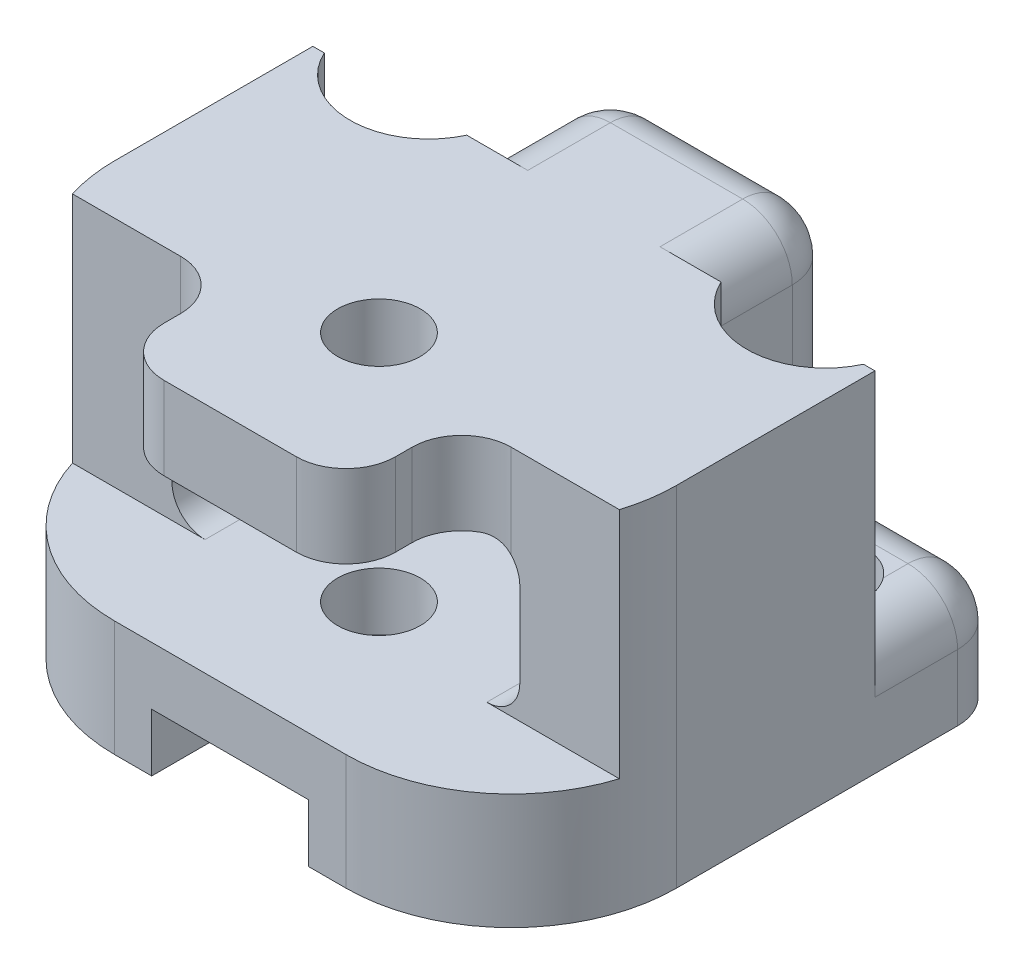
from build123d import *

# Parameters (mm, degrees)
CROQUIS1_W              = 34
CROQUIS1_H              = 30
CROQUIS1_R              = 2.5
SALIENTE_EXTRUIR1_DEPTH = 7
REDONDEO1_R             = 10
CROQUIS2_W              = 14
CROQUIS2_H              = 30
SALIENTE_EXTRUIR2_DEPTH = 14.1
CORTAR_EXTRUIR1_REACH   = 45.832
CORTAR_EXTRUIR2_REACH   = 52.012
CROQUIS4_R              = 2.5
CROQUIS5_W              = 9.5
CROQUIS5_H              = 3.5
CORTAR_EXTRUIR3_DEPTH   = 20
SALIENTE_EXTRUIR3_DEPTH = 5
SALIENTE_EXTRUIR4_DEPTH = 9.1
CORTAR_EXTRUIR4_REACH   = 52.012
CROQUIS8_R              = 4.75
REDONDEO5_R             = 2
REDONDEO6_R             = 3
REDONDEO7_R             = 3


with BuildPart() as part:
    # Croquis1 → Saliente-Extruir1 (new body)
    with BuildSketch(Plane(origin=(0, 0, 0), x_dir=(1, 0, 0), z_dir=(0, 1, 0))):
        with Locations((-17, -15)):
            Rectangle(CROQUIS1_W, CROQUIS1_H)
        with Locations(Location((-29, -6, 0), (0, 0, 90))):
            Circle(CROQUIS1_R, mode=Mode.SUBTRACT)
        with Locations(Location((-5, -6, 0), (0, 0, 90))):
            Circle(CROQUIS1_R, mode=Mode.SUBTRACT)
    extrude(amount=SALIENTE_EXTRUIR1_DEPTH)

    # Redondeo1
    redondeo1_edges = [part.edges().sort_by_distance(p)[0] for p in [
        (0, 3.5, 30),
        (-34, 3.5, 30),
    ]]
    fillet(redondeo1_edges, radius=REDONDEO1_R)

    # Croquis2 → Saliente-Extruir2 (add)
    with BuildSketch(Plane(origin=(0, 7, 0), x_dir=(1, 0, 0), z_dir=(0, 1, 0))):
        with Locations((-17, -15)):
            Rectangle(CROQUIS2_W, CROQUIS2_H)
    extrude(amount=SALIENTE_EXTRUIR2_DEPTH)

    # Croquis3 → Cortar-Extruir1 (cut, up to next)
    with BuildSketch(Plane.ZY.offset(24), mode=Mode.PRIVATE) as cortar_extruir1_sk1:
        with BuildLine():
            Line((9, 7), (30, 7))
            Line((30, 7), (30, 16.1))
            Line((30, 16.1), (23, 16.1))
            Line((23, 16.1), (9, 16.1))
            ThreePointArc((9, 16.1), (6.171572875, 14.928427125), (5, 12.1))
            Line((5, 12.1), (5, 11))
            ThreePointArc((5, 11), (6.171572875, 8.171572875), (9, 7))
        make_face()
    cortar_extruir1_tool1 = extrude(cortar_extruir1_sk1.sketch, amount=-CORTAR_EXTRUIR1_REACH, mode=Mode.PRIVATE) & part.part
    add(cortar_extruir1_tool1.solids().sort_by_distance((-24, 11.55, 17.861257))[0], mode=Mode.SUBTRACT)

    # Cortar-Extruir2: up to this face of the body (flat: up to its plane)
    cortar_extruir2_end = Plane(part.part.faces().sort_by_distance((-17, 0, 14.792595458))[0])
    # Croquis4 → Cortar-Extruir2 (cut, up to the picked face)
    with BuildSketch(Plane(origin=(0, 21.1, 0), x_dir=(1, 0, 0), z_dir=(0, 1, 0)), mode=Mode.PRIVATE) as cortar_extruir2_sk1:
        with Locations(Location((-17, -21, 0), (0, 0, 270))):
            Circle(CROQUIS4_R)
    cortar_extruir2_tool1 = split(extrude(cortar_extruir2_sk1.sketch, amount=-CORTAR_EXTRUIR2_REACH, mode=Mode.PRIVATE), bisect_by=cortar_extruir2_end, keep=Keep.BOTH, mode=Mode.PRIVATE)
    add(cortar_extruir2_tool1.solids().sort_by(Axis((-17, 21.1, 21), (0, -1, 0)))[0], mode=Mode.SUBTRACT)

    # Croquis5 → Cortar-Extruir3 (cut)
    with BuildSketch(Plane.XY.offset(30)):
        with Locations((-17, 1.75)):
            Rectangle(CROQUIS5_W, CROQUIS5_H)
    extrude(amount=-CORTAR_EXTRUIR3_DEPTH, mode=Mode.SUBTRACT)

    # Croquis6 → Saliente-Extruir3 (add)
    with BuildSketch(Plane(origin=(0, 21.1, 0), x_dir=(1, 0, 0), z_dir=(0, 1, 0))):
        with BuildLine():
            Line((-24, -23), (-33.539392014, -23))
            ThreePointArc((-33.539392014, -23), (-33.884177258, -21.517576993), (-34, -20))
            Line((-34, -20), (-34, -8))
            Line((-34, -8), (-24, -8))
            Line((-24, -8), (-24, -23))
        make_face()
        with BuildLine():
            Line((-10, -23), (-0.460607986, -23))
            ThreePointArc((-0.460607986, -23), (-0.115822742, -21.517576993), (0, -20))
            Line((0, -20), (0, -8))
            Line((0, -8), (-10, -8))
            Line((-10, -8), (-10, -23))
        make_face()
    extrude(amount=-SALIENTE_EXTRUIR3_DEPTH)

    # Croquis7 → Saliente-Extruir4 (add)
    with BuildSketch(Plane.XZ.offset(-16.1)):
        with BuildLine():
            Line((-27.52, 8), (-34, 8))
            Line((-34, 8), (-34, 20))
            ThreePointArc((-34, 20), (-33.884177258, 21.517576993), (-33.539392014, 23))
            Line((-33.539392014, 23), (-27.52, 23))
            Line((-27.52, 23), (-27.52, 8))
        make_face()
        with BuildLine():
            Line((0, 8), (0, 20))
            ThreePointArc((0, 20), (-0.115822742, 21.517576993), (-0.460607986, 23))
            Line((-0.460607986, 23), (-6.48, 23))
            Line((-6.48, 23), (-6.48, 8))
            Line((-6.48, 8), (0, 8))
        make_face()
    extrude(amount=SALIENTE_EXTRUIR4_DEPTH)

    # Cortar-Extruir4: up to this face of the body (flat: up to its plane)
    cortar_extruir4_end = Plane(part.part.faces().sort_by_distance((-17, 7, 16.508515524))[0])
    # Croquis8 → Cortar-Extruir4 (cut, up to the picked face)
    with BuildSketch(Plane(origin=(0, 21.1, 0), x_dir=(1, 0, 0), z_dir=(0, 1, 0)), mode=Mode.PRIVATE) as cortar_extruir4_sk1:
        with Locations((-29, -6)):
            Circle(CROQUIS8_R)
    cortar_extruir4_tool1 = split(extrude(cortar_extruir4_sk1.sketch, amount=-CORTAR_EXTRUIR4_REACH, mode=Mode.PRIVATE), bisect_by=cortar_extruir4_end, keep=Keep.BOTH, mode=Mode.PRIVATE)
    # Croquis8 → Cortar-Extruir4 (cut, up to the picked face)
    with BuildSketch(Plane(origin=(0, 21.1, 0), x_dir=(1, 0, 0), z_dir=(0, 1, 0)), mode=Mode.PRIVATE) as cortar_extruir4_sk2:
        with Locations((-5, -6)):
            Circle(CROQUIS8_R)
    cortar_extruir4_tool2 = split(extrude(cortar_extruir4_sk2.sketch, amount=-CORTAR_EXTRUIR4_REACH, mode=Mode.PRIVATE), bisect_by=cortar_extruir4_end, keep=Keep.BOTH, mode=Mode.PRIVATE)
    add(cortar_extruir4_tool1.solids().sort_by(Axis((-29, 21.1, 6), (0, -1, 0)))[0], mode=Mode.SUBTRACT)
    add(cortar_extruir4_tool2.solids().sort_by(Axis((-5, 21.1, 6), (0, -1, 0)))[0], mode=Mode.SUBTRACT)

    # Redondeo5
    redondeo5_edges = [part.edges().sort_by_distance(p)[0] for p in [
        (-6.48, 7, 16.756773139),
        (-6.48, 16.1, 16.756773139),
        (-27.52, 16.1, 16.756773139),
        (-27.52, 7, 16.756773139),
    ]]
    fillet(redondeo5_edges, radius=REDONDEO5_R)

    # Redondeo6
    redondeo6_edges = [part.edges().sort_by_distance(p)[0] for p in [
        (-24, 18.6, 23),
        (-10, 18.6, 23),
        (-10, 18.6, 30),
        (-24, 18.6, 30),
    ]]
    fillet(redondeo6_edges, radius=REDONDEO6_R)

    # Redondeo7
    # the kernel refuses this fillet: 3 mm, written as the material it takes off along each edge
    with BuildSketch(Plane(origin=(-3, 4, 3), x_dir=(0, 1, 0), z_dir=(0, 0, -1))) as redondeo7_piece_1_section:
        Polygon((0, 0), (REDONDEO7_R, 0), (REDONDEO7_R, REDONDEO7_R), (0, REDONDEO7_R), align=None)
    redondeo7_piece_1 = extrude(amount=REDONDEO7_R, mode=Mode.PRIVATE)
    redondeo7_piece_1 = redondeo7_piece_1 - Plane(origin=(-3, 4, 3), x_dir=(-0.7071067811865475, -0.7071067811865475, 0), z_dir=(0, 0, -1)) * Sphere(REDONDEO7_R, mode=Mode.PRIVATE)
    add(redondeo7_piece_1, mode=Mode.SUBTRACT)
    with BuildSketch(Plane(origin=(-31, 4, 3), x_dir=(0, 1, 0), z_dir=(-1, 0, 0))) as redondeo7_piece_2_section:
        Polygon((0, 0), (REDONDEO7_R, 0), (REDONDEO7_R, REDONDEO7_R), (0, REDONDEO7_R), align=None)
    redondeo7_piece_2 = extrude(amount=REDONDEO7_R, mode=Mode.PRIVATE)
    redondeo7_piece_2 = redondeo7_piece_2 - Plane(origin=(-31, 4, 3), x_dir=(0, -0.7071067811865475, 0.7071067811865475), z_dir=(-1, 0, 0)) * Sphere(REDONDEO7_R, mode=Mode.PRIVATE)
    add(redondeo7_piece_2, mode=Mode.SUBTRACT)
    with BuildSketch(Plane(origin=(-21, 18.1, 3), x_dir=(0, 1, 0), z_dir=(-1, 0, 0))) as redondeo7_piece_3_section:
        Polygon((0, 0), (REDONDEO7_R, 0), (REDONDEO7_R, REDONDEO7_R), (0, REDONDEO7_R), align=None)
    redondeo7_piece_3 = extrude(amount=REDONDEO7_R, mode=Mode.PRIVATE)
    redondeo7_piece_3 = redondeo7_piece_3 - Plane(origin=(-21, 18.1, 3), x_dir=(0, -0.7071067811865475, 0.7071067811865475), z_dir=(-1, 0, 0)) * Sphere(REDONDEO7_R, mode=Mode.PRIVATE)
    add(redondeo7_piece_3, mode=Mode.SUBTRACT)
    with BuildSketch(Plane(origin=(-13, 18.1, 3), x_dir=(1, 0, 0), z_dir=(0, 1, 0))) as redondeo7_piece_4_section:
        Polygon((0, 0), (REDONDEO7_R, 0), (REDONDEO7_R, REDONDEO7_R), (0, REDONDEO7_R), align=None)
    redondeo7_piece_4 = extrude(amount=REDONDEO7_R, mode=Mode.PRIVATE)
    redondeo7_piece_4 = redondeo7_piece_4 - Plane(origin=(-13, 18.1, 3), x_dir=(-0.7071067811865468, 0, 0.707106781186548), z_dir=(0, 1, 0)) * Sphere(REDONDEO7_R, mode=Mode.PRIVATE)
    add(redondeo7_piece_4, mode=Mode.SUBTRACT)
    with BuildSketch(Plane(origin=(0, -7.5, 0), x_dir=(0, 0, 1), z_dir=(0, 1, 0)), Plane(origin=(-34, -7.5, 0), x_dir=(1, 0, 0), z_dir=(0, 1, 0))) as redondeo7_piece_5:
        with BuildLine():
            CenterArc((REDONDEO7_R, -REDONDEO7_R), REDONDEO7_R, 90, 90)
            Line((0, -REDONDEO7_R), (0, 0))
            Line((0, 0), (REDONDEO7_R, 0))
        make_face()
    extrude(amount=11.5, mode=Mode.SUBTRACT)
    with BuildSketch(Plane(origin=(-34, 7, 3), x_dir=(1, 0, 0), z_dir=(0, 0, 1))) as redondeo7_piece_6_section:
        with BuildLine():
            CenterArc((REDONDEO7_R, -REDONDEO7_R), REDONDEO7_R, 90, 90)
            Line((0, -REDONDEO7_R), (0, 0))
            Line((0, 0), (REDONDEO7_R, 0))
        make_face()
    redondeo7_piece_6 = extrude(amount=5, mode=Mode.PRIVATE)
    redondeo7_piece_6 = redondeo7_piece_6 & Plane(origin=(-29, 6.638457851, 6), x_dir=(1, 0, 0), z_dir=(0, 1, 0)) * Cylinder(4.75, 23, mode=Mode.PRIVATE)
    add(redondeo7_piece_6, mode=Mode.SUBTRACT)
    with BuildSketch(Plane(origin=(-34, 7, 3), x_dir=(1, 0, 0), z_dir=(0, 0, 1))) as redondeo7_piece_7_section:
        with BuildLine():
            CenterArc((REDONDEO7_R, -REDONDEO7_R), REDONDEO7_R, 90, 90)
            Line((0, -REDONDEO7_R), (0, 0))
            Line((0, 0), (REDONDEO7_R, 0))
        make_face()
    redondeo7_piece_7 = extrude(amount=5, mode=Mode.PRIVATE)
    redondeo7_piece_7 = redondeo7_piece_7 - Plane(origin=(-29, 5.984939517, 6), x_dir=(1, 0, 0), z_dir=(0, 1, 0)) * Cylinder(4.75, 23, mode=Mode.PRIVATE)
    add(redondeo7_piece_7, mode=Mode.SUBTRACT)
    with BuildSketch(Plane(origin=(-34, 7, 3), x_dir=(1, 0, 0), z_dir=(0, 0, 1))) as redondeo7_piece_8_section:
        with BuildLine():
            CenterArc((REDONDEO7_R, -REDONDEO7_R), REDONDEO7_R, 90, 90)
            Line((0, -REDONDEO7_R), (0, 0))
            Line((0, 0), (REDONDEO7_R, 0))
        make_face()
    redondeo7_piece_8 = extrude(amount=12.5, mode=Mode.PRIVATE)
    redondeo7_piece_8 = split(redondeo7_piece_8, bisect_by=Plane(origin=(-32.327413767, 6.840048654, 8), z_dir=(0, 0, 1)), keep=Keep.TOP, mode=Mode.PRIVATE)
    redondeo7_piece_8 = redondeo7_piece_8 & Plane(origin=(-29, 6.840048654, 6), x_dir=(1, 0, 0), z_dir=(0, 1, 0)) * Cylinder(4.75, 38, mode=Mode.PRIVATE)
    add(redondeo7_piece_8, mode=Mode.SUBTRACT)
    with BuildSketch(Plane(origin=(0, 7, 8), x_dir=(-1, 0, 0), z_dir=(0, 0, -1))) as redondeo7_piece_9_section:
        with BuildLine():
            CenterArc((REDONDEO7_R, -REDONDEO7_R), REDONDEO7_R, 90, 90)
            Line((0, -REDONDEO7_R), (0, 0))
            Line((0, 0), (REDONDEO7_R, 0))
        make_face()
    redondeo7_piece_9 = extrude(amount=5, mode=Mode.PRIVATE)
    redondeo7_piece_9 = redondeo7_piece_9 - Plane(origin=(-5, 5.984939497, 6), x_dir=(1, 0, 0), z_dir=(0, 1, 0)) * Cylinder(4.75, 23, mode=Mode.PRIVATE)
    add(redondeo7_piece_9, mode=Mode.SUBTRACT)
    with BuildSketch(Plane(origin=(0, 7, 15.5), x_dir=(-1, 0, 0), z_dir=(0, 0, -1))) as redondeo7_piece_10_section:
        with BuildLine():
            CenterArc((REDONDEO7_R, -REDONDEO7_R), REDONDEO7_R, 90, 90)
            Line((0, -REDONDEO7_R), (0, 0))
            Line((0, 0), (REDONDEO7_R, 0))
        make_face()
    redondeo7_piece_10 = extrude(amount=12.5, mode=Mode.PRIVATE)
    redondeo7_piece_10 = redondeo7_piece_10 & Plane(origin=(-5, 6.840048634, 6), x_dir=(1, 0, 0), z_dir=(0, 1, 0)) * Cylinder(4.75, 38, mode=Mode.PRIVATE)
    redondeo7_piece_10 = split(redondeo7_piece_10, bisect_by=Plane(origin=(-1.672586324, 6.840048634, 8), z_dir=(0, 0, 1)), keep=Keep.TOP, mode=Mode.PRIVATE)
    add(redondeo7_piece_10, mode=Mode.SUBTRACT)
    with BuildSketch(Plane(origin=(0, 7, 8), x_dir=(-1, 0, 0), z_dir=(0, 0, -1))) as redondeo7_piece_11_section:
        with BuildLine():
            CenterArc((REDONDEO7_R, -REDONDEO7_R), REDONDEO7_R, 90, 90)
            Line((0, -REDONDEO7_R), (0, 0))
            Line((0, 0), (REDONDEO7_R, 0))
        make_face()
    redondeo7_piece_11 = extrude(amount=5, mode=Mode.PRIVATE)
    redondeo7_piece_11 = redondeo7_piece_11 & Plane(origin=(-5, 6.638457797, 6), x_dir=(1, 0, 0), z_dir=(0, 1, 0)) * Cylinder(4.75, 23, mode=Mode.PRIVATE)
    add(redondeo7_piece_11, mode=Mode.SUBTRACT)
    with BuildSketch(Plane(origin=(-3, 7, 0), x_dir=(0, 0, 1), z_dir=(-1, 0, 0)), Plane(origin=(-24, 7, 0), x_dir=(0, 0, 1), z_dir=(-1, 0, 0))) as redondeo7_piece_12:
        with BuildLine():
            CenterArc((REDONDEO7_R, -REDONDEO7_R), REDONDEO7_R, 90, 90)
            Line((0, -REDONDEO7_R), (0, 0))
            Line((0, 0), (REDONDEO7_R, 0))
        make_face()
    extrude(amount=7, mode=Mode.SUBTRACT)
    with BuildSketch(Plane(origin=(-24, 21.1, 3), x_dir=(1, 0, 0), z_dir=(0, 0, 1)), Plane(origin=(-10, 21.1, 8), x_dir=(-1, 0, 0), z_dir=(0, 0, -1))) as redondeo7_piece_13:
        with BuildLine():
            CenterArc((REDONDEO7_R, -REDONDEO7_R), REDONDEO7_R, 90, 90)
            Line((0, -REDONDEO7_R), (0, 0))
            Line((0, 0), (REDONDEO7_R, 0))
        make_face()
    extrude(amount=5, mode=Mode.SUBTRACT)
    with BuildSketch(Plane(origin=(-10, 7, 0), x_dir=(0, 0, 1), z_dir=(0, 1, 0)), Plane(origin=(-24, 7, 0), x_dir=(1, 0, 0), z_dir=(0, 1, 0))) as redondeo7_piece_14:
        with BuildLine():
            CenterArc((REDONDEO7_R, -REDONDEO7_R), REDONDEO7_R, 90, 90)
            Line((0, -REDONDEO7_R), (0, 0))
            Line((0, 0), (REDONDEO7_R, 0))
        make_face()
    extrude(amount=11.1, mode=Mode.SUBTRACT)
    with BuildSketch(Plane(origin=(-13, 21.1, 0), x_dir=(0, 0, 1), z_dir=(-1, 0, 0))) as redondeo7_piece_15:
        with BuildLine():
            CenterArc((REDONDEO7_R, -REDONDEO7_R), REDONDEO7_R, 90, 90)
            Line((0, -REDONDEO7_R), (0, 0))
            Line((0, 0), (REDONDEO7_R, 0))
        make_face()
    extrude(amount=8, mode=Mode.SUBTRACT)
    with BuildSketch(Plane(origin=(-3, 7, 0), x_dir=(0, 0, 1), z_dir=(-1, 0, 0))) as redondeo7_piece_16a_section:
        with BuildLine():
            CenterArc((REDONDEO7_R, -REDONDEO7_R), REDONDEO7_R, 90, 90)
            Line((0, -REDONDEO7_R), (0, 0))
            Line((0, 0), (REDONDEO7_R, 0))
        make_face()
    redondeo7_piece_16a = extrude(amount=14.5, mode=Mode.PRIVATE)
    redondeo7_piece_16a = split(redondeo7_piece_16a, bisect_by=Plane(origin=(-10, 6.320814657, 0.679185343), z_dir=(-1, 0, 0)), keep=Keep.TOP, mode=Mode.PRIVATE)
    with BuildSketch(Plane(origin=(-10, -0.5, 0), x_dir=(0, 0, 1), z_dir=(0, 1, 0))) as redondeo7_piece_16b_section:
        with BuildLine():
            CenterArc((REDONDEO7_R, -REDONDEO7_R), REDONDEO7_R, 90, 90)
            Line((0, -REDONDEO7_R), (0, 0))
            Line((0, 0), (REDONDEO7_R, 0))
        make_face()
    redondeo7_piece_16b = extrude(amount=18.6, mode=Mode.PRIVATE)
    redondeo7_piece_16b = split(redondeo7_piece_16b, bisect_by=Plane(origin=(-10.679185343, 7, 0.679185343), z_dir=(0, -1, 0)), keep=Keep.TOP, mode=Mode.PRIVATE)
    redondeo7_piece_16 = redondeo7_piece_16a & redondeo7_piece_16b
    add(redondeo7_piece_16, mode=Mode.SUBTRACT)
    with BuildSketch(Plane(origin=(-16.5, 7, 0), x_dir=(0, 0, 1), z_dir=(-1, 0, 0))) as redondeo7_piece_17a_section:
        with BuildLine():
            CenterArc((REDONDEO7_R, -REDONDEO7_R), REDONDEO7_R, 90, 90)
            Line((0, -REDONDEO7_R), (0, 0))
            Line((0, 0), (REDONDEO7_R, 0))
        make_face()
    redondeo7_piece_17a = extrude(amount=14.5, mode=Mode.PRIVATE)
    redondeo7_piece_17a = split(redondeo7_piece_17a, bisect_by=Plane(origin=(-24, 6.320814657, 0.679185343), z_dir=(1, 0, 0)), keep=Keep.TOP, mode=Mode.PRIVATE)
    with BuildSketch(Plane(origin=(-24, -0.5, 0), x_dir=(1, 0, 0), z_dir=(0, 1, 0))) as redondeo7_piece_17b_section:
        with BuildLine():
            CenterArc((REDONDEO7_R, -REDONDEO7_R), REDONDEO7_R, 90, 90)
            Line((0, -REDONDEO7_R), (0, 0))
            Line((0, 0), (REDONDEO7_R, 0))
        make_face()
    redondeo7_piece_17b = extrude(amount=18.6, mode=Mode.PRIVATE)
    redondeo7_piece_17b = split(redondeo7_piece_17b, bisect_by=Plane(origin=(-23.320814657, 7, 0.679185343), z_dir=(0, -1, 0)), keep=Keep.TOP, mode=Mode.PRIVATE)
    redondeo7_piece_17 = redondeo7_piece_17a & redondeo7_piece_17b
    add(redondeo7_piece_17, mode=Mode.SUBTRACT)


solid = part.part
